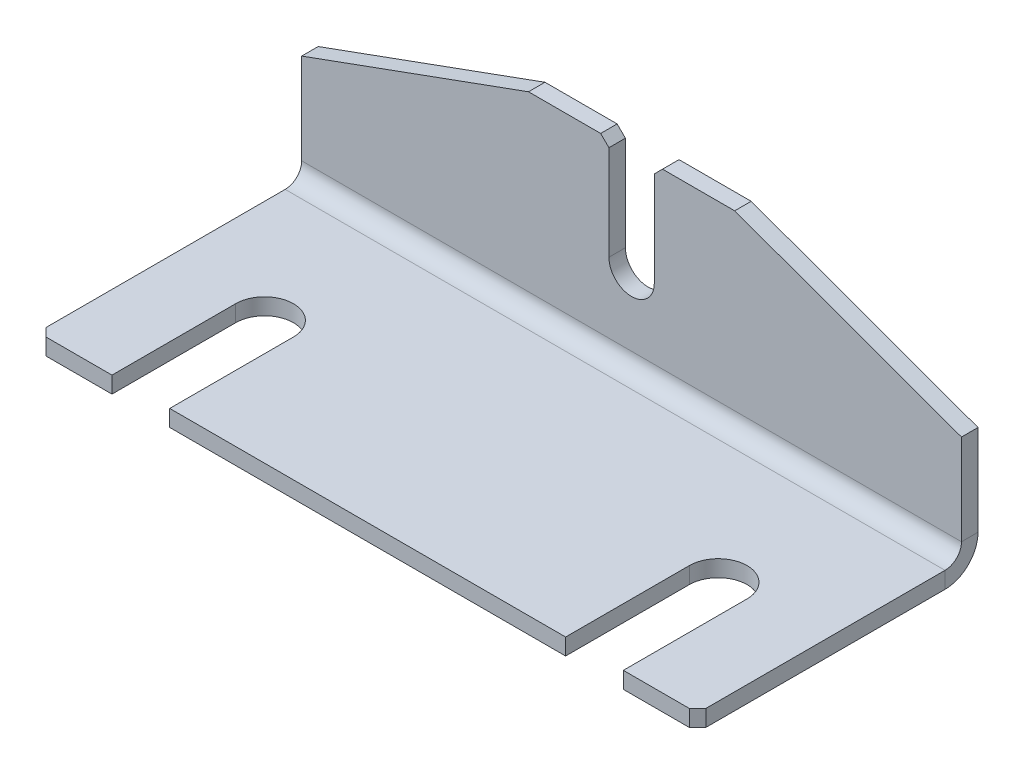
from build123d import *

# Parameters (mm, degrees)
BASE_FLANGE1_DEPTH      = 4
EDGE_FLANGE1_DEPTH      = 160
EDGE_FLANGE1_START      = -4
EDGE_FLANGE1_FLAT_DEPTH = 4
CHAMFER1_SIZE           = 2


# Sheet-metal steps are written as plain solids
with BuildPart() as part:
    # Sketch1 → Base-Flange1 (new body)
    with BuildSketch(Plane(origin=(0, 0, 0), x_dir=(1, 0, 0), z_dir=(0, 1, 0))):
        with BuildLine():
            Line((0, 0), (18, 0))
            Line((18, 0), (18, 30))
            ThreePointArc((18, 30), (25, 37), (32, 30))
            Line((32, 30), (32, 0))
            Line((32, 0), (128, 0))
            Line((128, 0), (128, 30))
            ThreePointArc((128, 30), (135, 37), (142, 30))
            Line((142, 30), (142, 0))
            Line((142, 0), (160, 0))
            Line((160, 0), (160, 60))
            Line((160, 60), (0, 60))
            Line((0, 60), (0, 0))
        make_face()
    extrude(amount=-BASE_FLANGE1_DEPTH)

    # Edge-Flange1 bend section (across the edge) → Edge-Flange1 (add)
    with BuildSketch(Plane(origin=(160, 0, -64), x_dir=(0, 0, 1), z_dir=(-1, 0, 0))):
        with BuildLine():
            Line((-4, 4), (0, 4))
            ThreePointArc((0, 4), (1.171572875, 1.171572875), (4, 0))
            Line((4, 0), (4, -4))
            ThreePointArc((4, -4), (-1.656854249, -1.656854249), (-4, 4))
        make_face()
    extrude(amount=EDGE_FLANGE1_DEPTH)

    # Edge-Flange1 profile (on flange) → Edge-Flange1 flat (add)
    with BuildSketch(Plane.XY.offset(-64).offset(EDGE_FLANGE1_START)):
        with BuildLine():
            Line((0, 4), (160, 4))
            Line((160, 4), (160, 26))
            Line((160, 26), (105, 46))
            Line((105, 46), (87.5, 46))
            Line((87.5, 46), (85.5, 44))
            Line((85.5, 44), (85.5, 21))
            ThreePointArc((85.5, 21), (80, 15.5), (74.5, 21))
            Line((74.5, 21), (74.5, 44))
            Line((74.5, 44), (72.5, 46))
            Line((72.5, 46), (55, 46))
            Line((55, 46), (0, 26))
            Line((0, 26), (0, 4))
        make_face()
    extrude(amount=EDGE_FLANGE1_FLAT_DEPTH)

    # Chamfer1
    chamfer1_edges = [part.edges().sort_by_distance(p)[0] for p in [
        (160, -2, 0),
        (0, -2, 0),
    ]]
    chamfer(chamfer1_edges, length=CHAMFER1_SIZE)


solid = part.part
